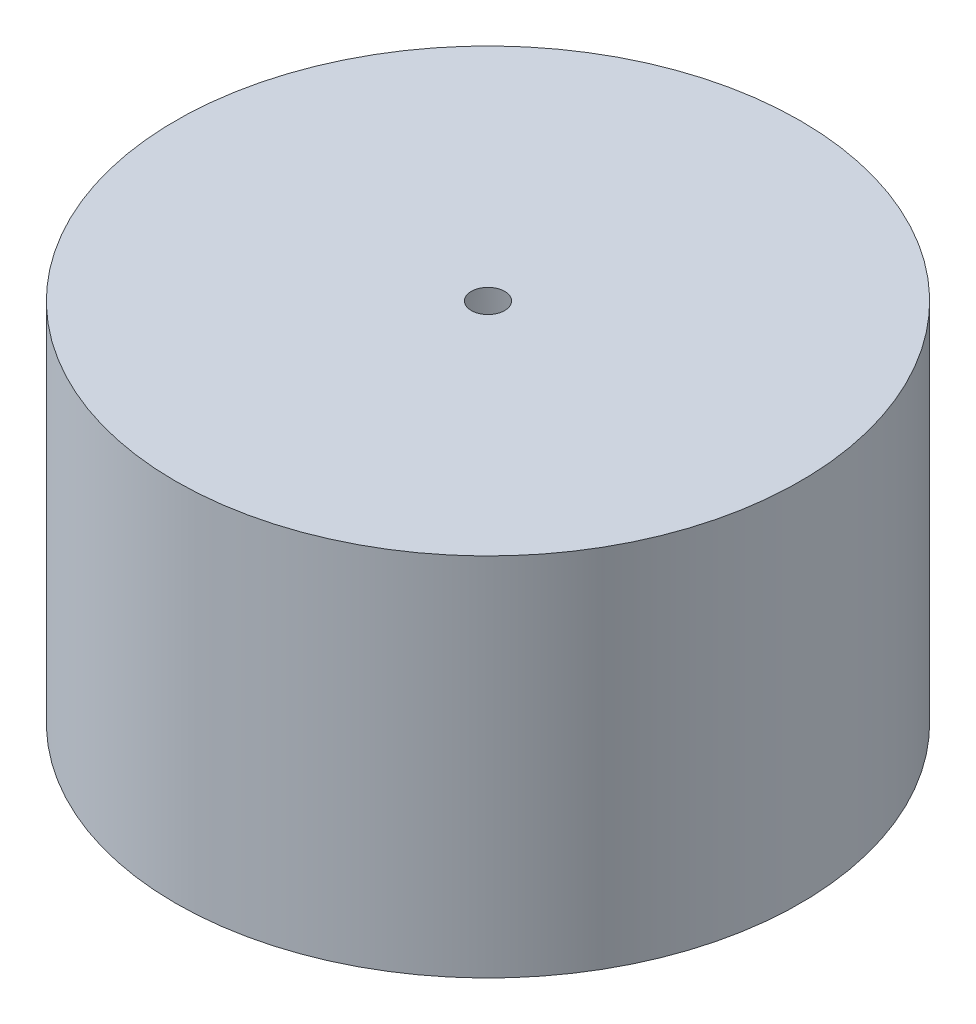
from build123d import *


with BuildPart() as part:
    # Эскиз1 → Повернуть1 (revolve)
    with BuildSketch(Plane.XY):
        with BuildLine():
            Line((30, 28.7946265), (30, 26.2946265))
            Line((30, 26.2946265), (28.4, 26.2946265))
            Line((28.4, 26.2946265), (28.4, 18.2946265))
            Line((28.4, 18.2946265), (37.427682956, 18.2946265))
            Line((37.427682956, 18.2946265), (37.427682956, 62.097891733))
            Line((37.427682956, 62.097891733), (2, 62.097891733))
            Line((2, 62.097891733), (8, 58.633790118))
            Line((8, 58.633790118), (8.347561618, 52.001919373))
            Line((8.347561618, 52.001919373), (10.747561618, 49.401919373))
            Line((10.747561618, 49.401919373), (10.967213258, 43.111919373))
            ThreePointArc((10.967213258, 43.111919373), (12.737639238, 42.17467164), (11.997561618, 40.313186593))
            Line((11.997561618, 40.313186593), (12.218210599, 33.9946265))
            Line((12.218210599, 33.9946265), (16.630248319, 29.9946265))
            Line((16.630248319, 29.9946265), (30, 29.9946265))
            Line((30, 29.9946265), (30, 28.7946265))
        make_face()
    revolve(axis=Axis((0, 0, 0), (0, 1, 0)))


solid = part.part
